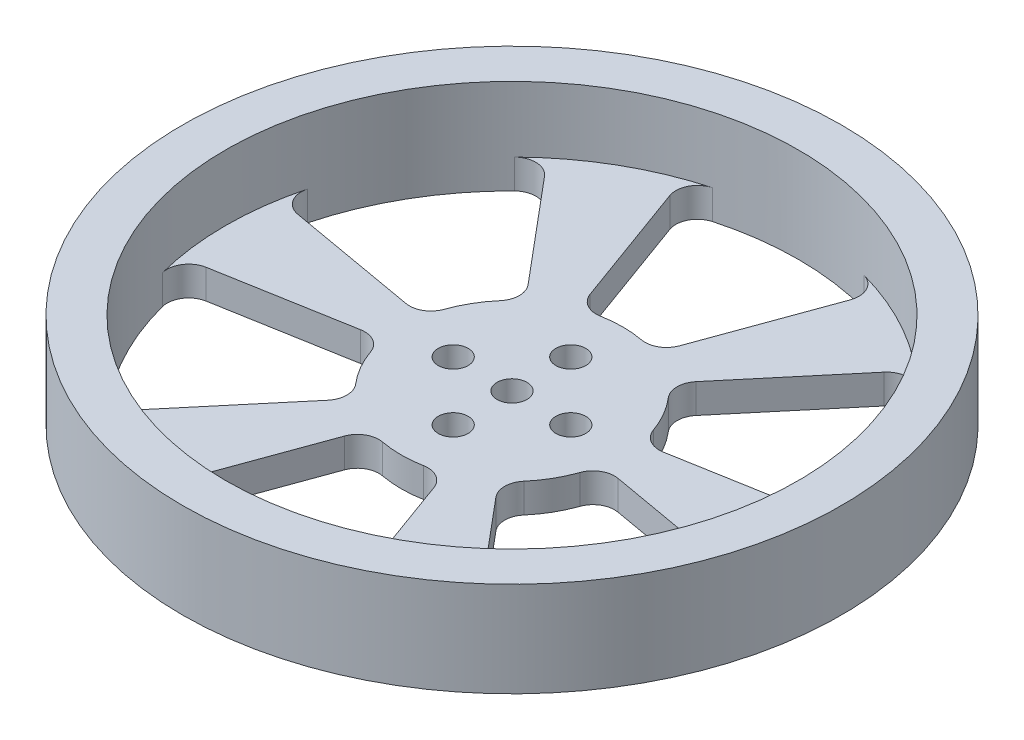
from build123d import *
from build123d.topology import SkipClean

# Parameters (mm, degrees)
SKETCH1_R            = 24.257
BOSS_EXTRUDE1_DEPTH  = 4.445
M2_CLEARANCE_HOLE1_D = 2.2
SKETCH4_R            = 21.082
CUT_EXTRUDE1_DEPTH   = 2.286
CUT_EXTRUDE2_DEPTH   = 35.380661628
FILLET1_DEPTH        = 2.159
BOSS_EXTRUDE2_START  = 2.54
SKETCH6_R            = 24.257
SKETCH6_R_2          = 21.082
BOSS_EXTRUDE2_DEPTH  = 2.54


with BuildPart() as part:
    # Sketch1 → Boss-Extrude1 (new body)
    with BuildSketch(Plane(origin=(0, 0, 0), x_dir=(1, 0, 0), z_dir=(0, 1, 0))):
        with Locations(Location((0, 0, 0), (0, 0, 270))):
            Circle(SKETCH1_R)
    extrude(amount=BOSS_EXTRUDE1_DEPTH)

    # M2 Clearance Hole1 (through all)
    with Locations(Plane(origin=(0, 4.445, 0), x_dir=(1, 0, 0), z_dir=(0, 1, 0))):
        with Locations((0, 0), (0, 4.32848345), (0, -4.32848345), (-4.32848345, 0), (4.32848345, 0)):
            Hole(M2_CLEARANCE_HOLE1_D / 2)

    # Sketch4 → Cut-Extrude1 (cut)
    with BuildSketch(Plane(origin=(0, 4.445, 0), x_dir=(1, 0, 0), z_dir=(0, 1, 0))):
        with Locations(Location((0, 0, 0), (0, 0, 270))):
            Circle(SKETCH4_R)
    extrude(amount=-CUT_EXTRUDE1_DEPTH, mode=Mode.SUBTRACT)

    # Sketch5 → Cut-Extrude2 (cut, through all)
    with SkipClean():  # the faces are left unmerged after this step: merging them gives an invalid solid
        with BuildSketch(Plane(origin=(0, 2.159, 0), x_dir=(1, 0, 0), z_dir=(0, 1, 0))):
            with BuildLine():
                Line((-2.790798865, 7.667656862), (-7.210468662, 19.810599831))
                ThreePointArc((-7.210468662, 19.810599831), (0, 21.082), (7.210468662, 19.810599831))
                Line((7.210468662, 19.810599831), (2.790798865, 7.667656862))
                ThreePointArc((2.790798865, 7.667656862), (0, 8.15975), (-2.790798865, 7.667656862))
            make_face()
            with BuildLine():
                Line((5.244986198, 6.250731145), (13.551248387, 16.14974895))
                ThreePointArc((13.551248387, 16.14974895), (18.257547563, 10.541), (20.761717049, 3.660850882))
                Line((20.761717049, 3.660850882), (8.035785063, 1.416925718))
                ThreePointArc((8.035785063, 1.416925718), (7.066550789, 4.079875), (5.244986198, 6.250731145))
            make_face()
            with BuildLine():
                Line((8.035785063, -1.416925718), (20.761717049, -3.660850882))
                ThreePointArc((20.761717049, -3.660850882), (18.257547563, -10.541), (13.551248387, -16.14974895))
                Line((13.551248387, -16.14974895), (5.244986198, -6.250731145))
                ThreePointArc((5.244986198, -6.250731145), (7.066550789, -4.079875), (8.035785063, -1.416925718))
            make_face()
            with BuildLine():
                Line((2.790798865, -7.667656862), (7.210468662, -19.810599831))
                ThreePointArc((7.210468662, -19.810599831), (0, -21.082), (-7.210468662, -19.810599831))
                Line((-7.210468662, -19.810599831), (-2.790798865, -7.667656862))
                ThreePointArc((-2.790798865, -7.667656862), (0, -8.15975), (2.790798865, -7.667656862))
            make_face()
            with BuildLine():
                Line((-5.244986198, -6.250731145), (-13.551248387, -16.14974895))
                ThreePointArc((-13.551248387, -16.14974895), (-18.257547563, -10.541), (-20.761717049, -3.660850882))
                Line((-20.761717049, -3.660850882), (-8.035785063, -1.416925718))
                ThreePointArc((-8.035785063, -1.416925718), (-7.066550789, -4.079875), (-5.244986198, -6.250731145))
            make_face()
            with BuildLine():
                Line((-8.035785063, 1.416925718), (-20.761717049, 3.660850882))
                ThreePointArc((-20.761717049, 3.660850882), (-18.257547563, 10.541), (-13.551248387, 16.14974895))
                Line((-13.551248387, 16.14974895), (-5.244986198, 6.250731145))
                ThreePointArc((-5.244986198, 6.250731145), (-7.066550789, 4.079875), (-8.035785063, 1.416925718))
            make_face()
        extrude(amount=-CUT_EXTRUDE2_DEPTH, mode=Mode.SUBTRACT)

    # Fillet1: read off the stored shape, not the designer's step
    # Fillet1 outline → Fillet1 (add)
    with SkipClean():  # the faces are left unmerged after this step: merging them gives an invalid solid
        with BuildSketch(Plane(origin=(0, 0, 0), x_dir=(1, 0, 0), z_dir=(0, 1, 0))):
            with BuildLine():
                ThreePointArc((-5.573280223, -20.331976578), (-6.563834268, -19.529933732), (-6.645367543, -18.257997268))
                Line((-6.645367543, -18.257997268), (-7.210468662, -19.810599831))
                ThreePointArc((-7.210468662, -19.810599831), (-6.397188235, -20.087974181), (-5.573280223, -20.331976578))
            make_face()
            with BuildLine():
                Line((-2.790798865, -7.667656862), (-3.289243946, -9.037123468))
                ThreePointArc((-3.289243946, -9.037123468), (-2.583701402, -8.200944789), (-1.504732413, -8.019806757))
                ThreePointArc((-1.504732413, -8.019806757), (-2.154970911, -7.870045771), (-2.790798865, -7.667656862))
            make_face()
            with BuildLine():
                ThreePointArc((6.645367543, -18.257997268), (6.563834268, -19.529933732), (5.573280223, -20.331976578))
                ThreePointArc((5.573280223, -20.331976578), (6.397188235, -20.087974181), (7.210468662, -19.810599831))
                Line((7.210468662, -19.810599831), (6.645367543, -18.257997268))
            make_face()
            with BuildLine():
                ThreePointArc((-14.821368114, -14.992590544), (-14.198101834, -15.584114615), (-13.551248387, -16.14974895))
                Line((-13.551248387, -16.14974895), (-12.489205685, -14.884055743))
                ThreePointArc((-12.489205685, -14.884055743), (-13.631501612, -15.449414088), (-14.821368114, -14.992590544))
            make_face()
            with BuildLine():
                ThreePointArc((2.790798865, -7.667656862), (2.154970911, -7.870045771), (1.504732413, -8.019806757))
                ThreePointArc((1.504732413, -8.019806757), (2.583701402, -8.200944789), (3.289243946, -9.037123468))
                Line((3.289243946, -9.037123468), (2.790798865, -7.667656862))
            make_face()
            with BuildLine():
                Line((12.489205685, -14.884055743), (13.551248387, -16.14974895))
                ThreePointArc((13.551248387, -16.14974895), (14.198101834, -15.584114615), (14.821368114, -14.992590544))
                ThreePointArc((14.821368114, -14.992590544), (13.631501612, -15.449414088), (12.489205685, -14.884055743))
            make_face()
            with BuildLine():
                ThreePointArc((-6.192990179, -5.313039875), (-5.810375821, -6.338023444), (-6.181756528, -7.36713055))
                Line((-6.181756528, -7.36713055), (-5.244986198, -6.250731145))
                ThreePointArc((-5.244986198, -6.250731145), (-5.738174111, -5.801282439), (-6.192990179, -5.313039875))
            make_face()
            with BuildLine():
                ThreePointArc((-20.761717049, -3.660850882), (-20.595290068, -4.503859567), (-20.394648337, -5.339386034))
                ThreePointArc((-20.394648337, -5.339386034), (-20.19533588, -4.080519643), (-19.134573227, -3.373941524))
                Line((-19.134573227, -3.373941524), (-20.761717049, -3.660850882))
            make_face()
            with BuildLine():
                Line((5.244986198, -6.250731145), (6.181756528, -7.36713055))
                ThreePointArc((6.181756528, -7.36713055), (5.810375821, -6.338023444), (6.192990179, -5.313039875))
                ThreePointArc((6.192990179, -5.313039875), (5.738174111, -5.801282439), (5.244986198, -6.250731145))
            make_face()
            with BuildLine():
                ThreePointArc((19.134573227, -3.373941524), (20.19533588, -4.080519643), (20.394648337, -5.339386034))
                ThreePointArc((20.394648337, -5.339386034), (20.595290068, -4.503859567), (20.761717049, -3.660850882))
                Line((20.761717049, -3.660850882), (19.134573227, -3.373941524))
            make_face()
            with BuildLine():
                ThreePointArc((-9.471000473, -1.669992918), (-8.394077223, -1.862921344), (-7.697722592, -2.706766883))
                ThreePointArc((-7.697722592, -2.706766883), (-7.893145022, -2.068763332), (-8.035785063, -1.416925718))
                Line((-8.035785063, -1.416925718), (-9.471000473, -1.669992918))
            make_face()
            with BuildLine():
                ThreePointArc((-20.394648337, 5.339386034), (-20.595290068, 4.503859567), (-20.761717049, 3.660850882))
                Line((-20.761717049, 3.660850882), (-19.134573227, 3.373941524))
                ThreePointArc((-19.134573227, 3.373941524), (-20.19533588, 4.080519643), (-20.394648337, 5.339386034))
            make_face()
            with BuildLine():
                ThreePointArc((8.035785063, -1.416925718), (7.893145022, -2.068763332), (7.697722592, -2.706766883))
                ThreePointArc((7.697722592, -2.706766883), (8.394077223, -1.862921344), (9.471000473, -1.669992918))
                Line((9.471000473, -1.669992918), (8.035785063, -1.416925718))
            make_face()
            with BuildLine():
                ThreePointArc((-7.697722592, 2.706766883), (-8.394077223, 1.862921344), (-9.471000473, 1.669992918))
                Line((-9.471000473, 1.669992918), (-8.035785063, 1.416925718))
                ThreePointArc((-8.035785063, 1.416925718), (-7.893145022, 2.068763332), (-7.697722592, 2.706766883))
            make_face()
            with BuildLine():
                ThreePointArc((-13.551248387, 16.14974895), (-14.198101834, 15.584114615), (-14.821368114, 14.992590544))
                ThreePointArc((-14.821368114, 14.992590544), (-13.631501612, 15.449414088), (-12.489205685, 14.884055743))
                Line((-12.489205685, 14.884055743), (-13.551248387, 16.14974895))
            make_face()
            with BuildLine():
                Line((19.134573227, 3.373941524), (20.761717049, 3.660850882))
                ThreePointArc((20.761717049, 3.660850882), (20.595290068, 4.503859567), (20.394648337, 5.339386034))
                ThreePointArc((20.394648337, 5.339386034), (20.19533588, 4.080519643), (19.134573227, 3.373941524))
            make_face()
            with BuildLine():
                ThreePointArc((-6.181756528, 7.36713055), (-5.810375821, 6.338023444), (-6.192990179, 5.313039875))
                ThreePointArc((-6.192990179, 5.313039875), (-5.738174111, 5.801282439), (-5.244986198, 6.250731145))
                Line((-5.244986198, 6.250731145), (-6.181756528, 7.36713055))
            make_face()
            with BuildLine():
                ThreePointArc((-5.573280223, 20.331976578), (-6.397188235, 20.087974181), (-7.210468662, 19.810599831))
                Line((-7.210468662, 19.810599831), (-6.645367543, 18.257997268))
                ThreePointArc((-6.645367543, 18.257997268), (-6.563834268, 19.529933732), (-5.573280223, 20.331976578))
            make_face()
            with BuildLine():
                Line((8.035785063, 1.416925718), (9.471000473, 1.669992918))
                ThreePointArc((9.471000473, 1.669992918), (8.394077223, 1.862921344), (7.697722592, 2.706766883))
                ThreePointArc((7.697722592, 2.706766883), (7.893145022, 2.068763332), (8.035785063, 1.416925718))
            make_face()
            with BuildLine():
                ThreePointArc((12.489205685, 14.884055743), (13.631501612, 15.449414088), (14.821368114, 14.992590544))
                ThreePointArc((14.821368114, 14.992590544), (14.198101834, 15.584114615), (13.551248387, 16.14974895))
                Line((13.551248387, 16.14974895), (12.489205685, 14.884055743))
            make_face()
            with BuildLine():
                ThreePointArc((-1.504732413, 8.019806757), (-2.583701402, 8.200944789), (-3.289243946, 9.037123468))
                Line((-3.289243946, 9.037123468), (-2.790798865, 7.667656862))
                ThreePointArc((-2.790798865, 7.667656862), (-2.154970911, 7.870045771), (-1.504732413, 8.019806757))
            make_face()
            with BuildLine():
                ThreePointArc((7.210468662, 19.810599831), (6.397188235, 20.087974181), (5.573280223, 20.331976578))
                ThreePointArc((5.573280223, 20.331976578), (6.563834268, 19.529933732), (6.645367543, 18.257997268))
                Line((6.645367543, 18.257997268), (7.210468662, 19.810599831))
            make_face()
            with BuildLine():
                ThreePointArc((5.244986198, 6.250731145), (5.738174111, 5.801282439), (6.192990179, 5.313039875))
                ThreePointArc((6.192990179, 5.313039875), (5.810375821, 6.338023444), (6.181756528, 7.36713055))
                Line((6.181756528, 7.36713055), (5.244986198, 6.250731145))
            make_face()
            with BuildLine():
                ThreePointArc((3.289243946, 9.037123468), (2.583701402, 8.200944789), (1.504732413, 8.019806757))
                ThreePointArc((1.504732413, 8.019806757), (2.154970911, 7.870045771), (2.790798865, 7.667656862))
                Line((2.790798865, 7.667656862), (3.289243946, 9.037123468))
            make_face()
        extrude(amount=FILLET1_DEPTH)

    # Sketch6 → Boss-Extrude2 (add)
    with SkipClean():  # the faces are left unmerged after this step: merging them gives an invalid solid
        with BuildSketch(Plane(origin=(0, 4.445, 0), x_dir=(1, 0, 0), z_dir=(0, 1, 0)).offset(BOSS_EXTRUDE2_START)):
            with Locations(Location((0, 0, 0), (0, 0, 270))):
                Circle(SKETCH6_R)
            with Locations(Location((0, 0, 0), (0, 0, 270))):
                Circle(SKETCH6_R_2, mode=Mode.SUBTRACT)
        extrude(amount=-BOSS_EXTRUDE2_DEPTH)


solid = part.part
